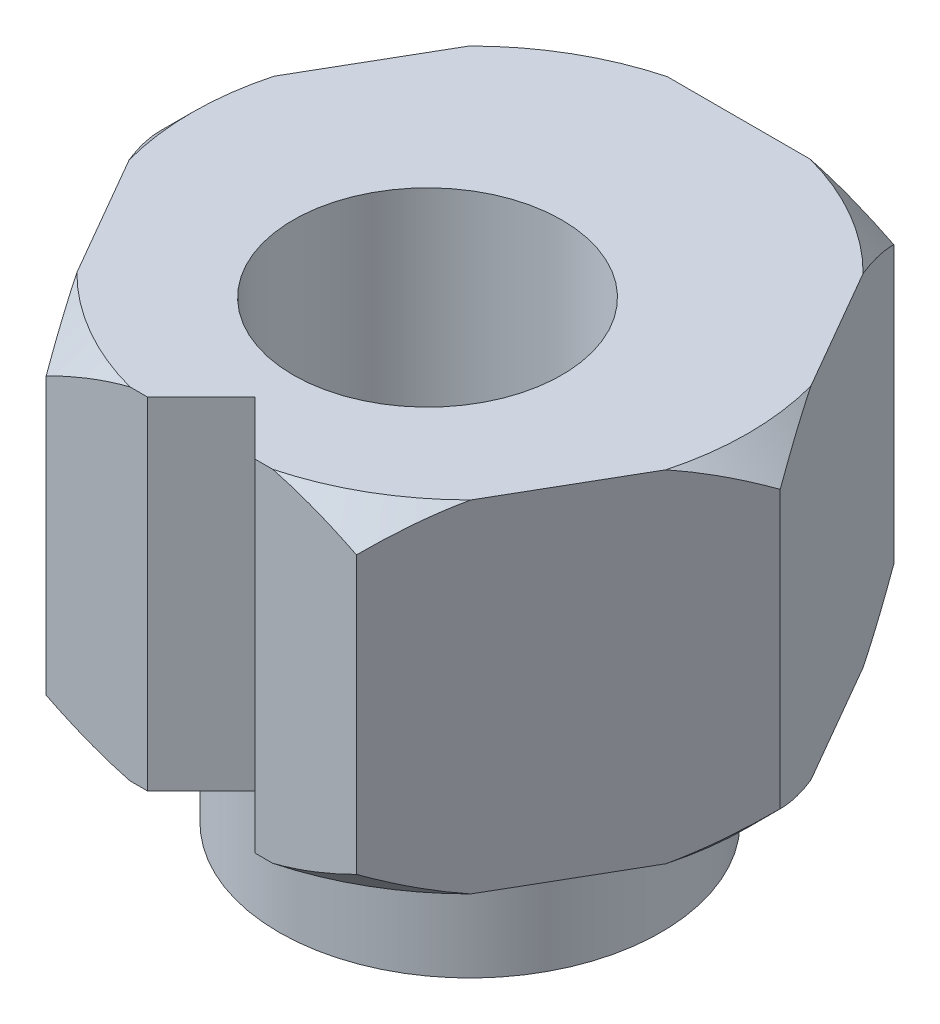
from build123d import *

# Parameters (mm, degrees)
BOSS_EXTRUDE1_DEPTH = 6.35
SKETCH3_R           = 3.555
BOSS_EXTRUDE3_DEPTH = 2.5
SKETCH4_R           = 2.5
CUT_EXTRUDE1_DEPTH  = 12.689988594
CUT_EXTRUDE2_DEPTH  = 10.932564288


with BuildPart() as part:
    # Sketch1 → Boss-Extrude1 (new body)
    with BuildSketch(Plane(origin=(0, 0, 0), x_dir=(1, 0, 0), z_dir=(0, 1, 0))):
        Polygon((5.773502692, 0), (2.886751346, 5), (-2.886751346, 5), (-5.773502692, 0), (-2.886751346, -5), (2.886751346, -5), align=None)
    extrude(amount=BOSS_EXTRUDE1_DEPTH)

    # Sketch3 → Boss-Extrude3 (add)
    with BuildSketch(Plane.XZ):
        Circle(SKETCH3_R)
    extrude(amount=BOSS_EXTRUDE3_DEPTH)

    # Sketch4 → Cut-Extrude1 (cut, through all)
    with BuildSketch(Plane(origin=(0, 6.35, 0), x_dir=(1, 0, 0), z_dir=(0, 1, 0))):
        with Locations((0, -0.79)):
            Circle(SKETCH4_R)
    extrude(amount=-CUT_EXTRUDE1_DEPTH, mode=Mode.SUBTRACT)

    # Sketch5 → Cut-Extrude2 (cut, through all)
    with BuildSketch(Plane(origin=(0, 0, 0), x_dir=(-1, 0, 0), z_dir=(0, -1, 0))):
        Polygon((-1, -5), (1, -5), (0, -4), align=None)
    extrude(amount=-CUT_EXTRUDE2_DEPTH, mode=Mode.SUBTRACT)

    # Sketch6 → Cut-Revolve1 (revolve, cut)
    with BuildSketch(Plane.XY):
        Polygon((5.173502692, 6.35), (5.773502692, 6.35), (5.773502692, 5.75), align=None)
        Polygon((5.773502692, 0.6), (5.173502692, 0), (5.773502692, 0), align=None)
    revolve(axis=Axis((0, 0, 0), (0, 1, 0)), mode=Mode.SUBTRACT)


solid = part.part
